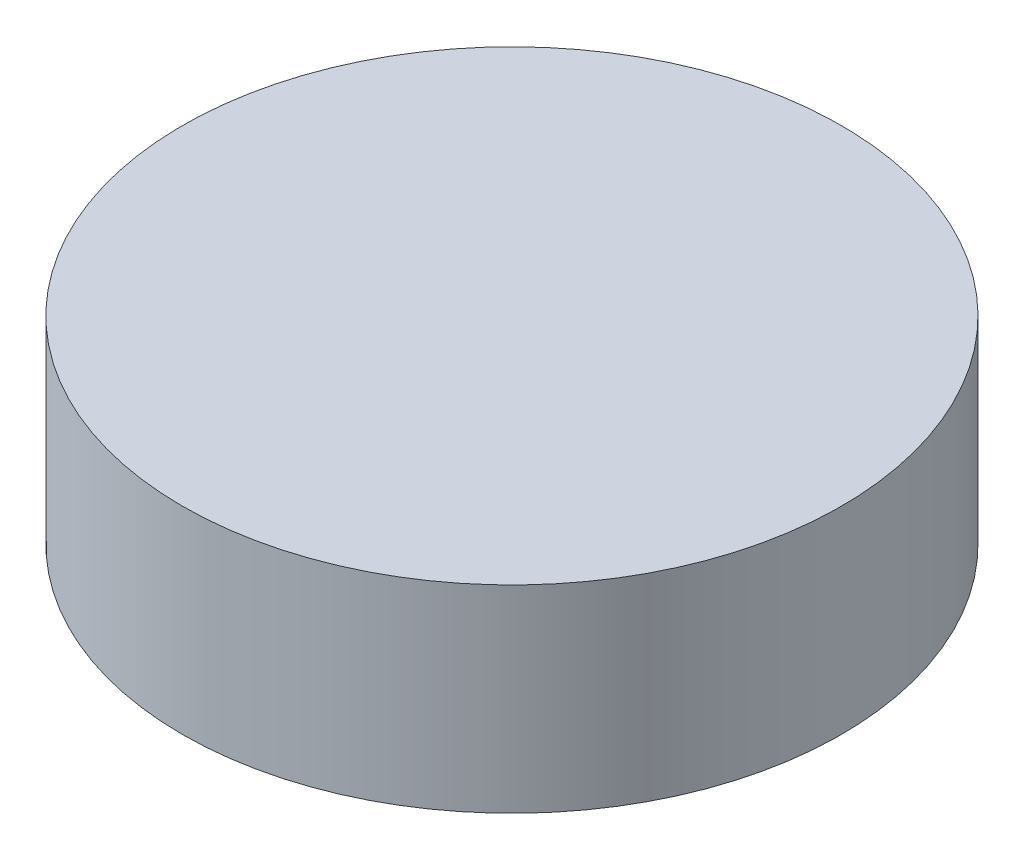
from build123d import *

# Parameters (mm, degrees)
SKETCH1_R           = 12
BOSS_EXTRUDE1_DEPTH = 7.2
SHELL1_START        = 1
SHELL1_OUTLINE_R    = 9.5
SHELL1_DEPTH        = 5.2


# Read off the part's stored shape, not the designer's step: Shell1
with BuildPart() as part:
    # Sketch1 → Boss-Extrude1 (new body)
    with BuildSketch(Plane(origin=(0, 0, 0), x_dir=(1, 0, 0), z_dir=(0, 1, 0))):
        with Locations(Location((0, 0, 0), (0, 0, 270))):
            Circle(SKETCH1_R)
    extrude(amount=BOSS_EXTRUDE1_DEPTH)

    # Shell1 outline → Shell1 (cut)
    with BuildSketch(Plane(origin=(0, 0, 0), x_dir=(1, 0, 0), z_dir=(0, 1, 0)).offset(SHELL1_START)):
        Circle(SHELL1_OUTLINE_R)
    extrude(amount=SHELL1_DEPTH, mode=Mode.SUBTRACT)


solid = part.part
